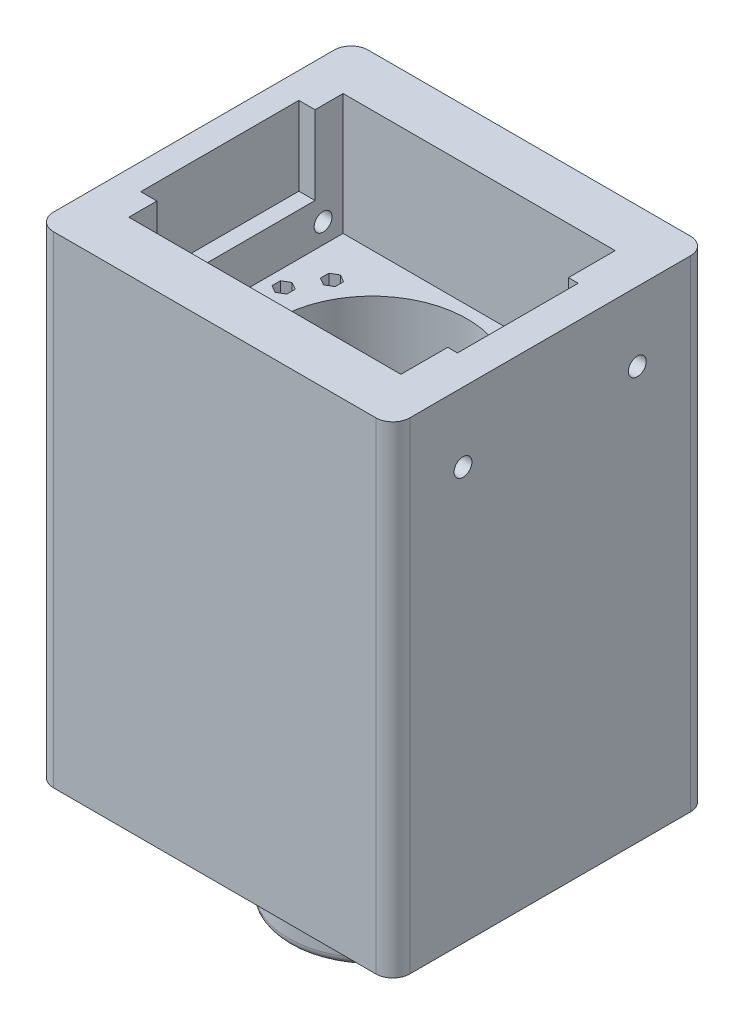
from build123d import *

# Parameters (mm, degrees)
SKETCH1_R                 = 9.8
BOSS_EXTRUDE1_DEPTH       = 15.7
FILLET1_R                 = 1
SKETCH3_W                 = 41.9
SKETCH3_H                 = 37
BOSS_EXTRUDE2_DEPTH       = 37.89
SKETCH2_R                 = 1.55
CUT_EXTRUDE1_DEPTH        = 61.440388814
SKETCH4_W                 = 4.95
SKETCH4_H                 = 37
BOSS_EXTRUDE3_DEPTH       = 14.25
CUT_EXTRUDE_START         = -14.25
CUT_EXTRUDE_2_OUTLINE_W   = 1.15
CUT_EXTRUDE_2_OUTLINE_H   = 14.2
CUT_EXTRUDE_2_OUTLINE_W_2 = 1.900000227
CUT_EXTRUDE_2_OUTLINE_H_2 = 18.6
CUT_EXTRUDE_2_DEPTH       = 14.25
CUT_EXTRUDE_1_REACH       = 83.854
SKETCH_1_R                = 1.05
CUT_EXTRUDE3_START        = -5
SKETCH6_R                 = 1.41
CUT_EXTRUDE3_DEPTH        = 69.371779997
FILLET5_R                 = 2
MOVE_START                = 11.2
MOVE_FACE_1_OUTLINE_R     = 9.8
MOVE_FACE_1_DEPTH         = 4.5
SKETCH_4_R                = 11.200313663
CUT_EXTRUDE_3_DEPTH       = 38.09
SKETCH_6_W                = 2.268388773
SKETCH_6_H                = 19.352707125
EXTRUDE_1_DEPTH           = 5
CUT_EXTRUDE2_REACH        = 83.854
SKETCH5_R                 = 1.05
SKETCH_7_W                = 33.485055755
SKETCH_7_H                = 15.84059592
EXTRUDE_2_DEPTH           = 5.9
SKETCH_8_W                = 34.098293505
SKETCH_8_H                = 15.557673108
EXTRUDE_3_DEPTH           = 5.9
OTHER_START               = 11.2
OTHER_1_DEPTH             = 42.39
SKETCH_9_R                = 3.5
CUT_EXTRUDE_4_DEPTH       = 5


# Read off the part's stored shape, not the designer's step: 切除-拉伸2, 移动面1, 填充阵列1
with BuildPart() as part:
    # Sketch1 → Boss-Extrude1 (new body)
    with BuildSketch(Plane(origin=(0, 0, 0), x_dir=(1, 0, 0), z_dir=(0, 1, 0))):
        with Locations(Location((0, 0, 0), (0, 0, 270))):
            Circle(SKETCH1_R)
    extrude(amount=BOSS_EXTRUDE1_DEPTH)

    # Fillet1
    fillet1_edges = [part.edges().sort_by_distance(p)[0] for p in [
        (0, 0, -9.8),
    ]]
    fillet(fillet1_edges, radius=FILLET1_R)

    # Sketch3 → Boss-Extrude2 (add)
    with BuildSketch(Plane(origin=(0, 15.7, 0), x_dir=(1, 0, 0), z_dir=(0, 1, 0))):
        Rectangle(SKETCH3_W, SKETCH3_H)
    extrude(amount=BOSS_EXTRUDE2_DEPTH)

    # Sketch2 → Cut-Extrude1 (cut, through all)
    with BuildSketch(Plane(origin=(0, 0, 0), x_dir=(-1, 0, 0), z_dir=(0, -1, 0))):
        with Locations(Location((0, 6.999998127, 0), (0, 0, 90))):
            Circle(SKETCH2_R)
        with Locations(Location((6.999998127, 0, 0), (0, 0, 90))):
            Circle(SKETCH2_R)
        with Locations(Location((0, -6.999998127, 0), (0, 0, 90))):
            Circle(SKETCH2_R)
        with Locations(Location((-6.999998127, 0, 0), (0, 0, 90))):
            Circle(SKETCH2_R)
    extrude(amount=-CUT_EXTRUDE1_DEPTH, mode=Mode.SUBTRACT)

    # Sketch4 → Boss-Extrude3 (add)
    with BuildSketch(Plane(origin=(0, 53.59, 0), x_dir=(1, 0, 0), z_dir=(0, 1, 0))):
        with Locations((-18.475, 0)):
            Rectangle(SKETCH4_W, SKETCH4_H)
        with Locations((18.475, 0)):
            Rectangle(SKETCH4_W, SKETCH4_H)
    extrude(amount=BOSS_EXTRUDE3_DEPTH)

    # 切除-拉伸2 outline → 切除-拉伸2 (cut)
    with BuildSketch(Plane(origin=(0, 67.84, 0), x_dir=(1, 0, 0), z_dir=(0, 1, 0)).offset(CUT_EXTRUDE_START)):
        with Locations((16.575, 0)):
            Rectangle(CUT_EXTRUDE_2_OUTLINE_W, CUT_EXTRUDE_2_OUTLINE_H)
        with Locations((-16.950000113, 0)):
            Rectangle(CUT_EXTRUDE_2_OUTLINE_W_2, CUT_EXTRUDE_2_OUTLINE_H_2)
    extrude(amount=CUT_EXTRUDE_2_DEPTH, mode=Mode.SUBTRACT)

    # 草图1 → 切除-拉伸1 (cut, up to next)
    with BuildSketch(Plane(origin=(20.95, 0, 0), x_dir=(0, 0, -1), z_dir=(1, 0, 0)), mode=Mode.PRIVATE) as cut_extrude_1_sk1:
        with Locations((-10.25, 59.7)):
            Circle(SKETCH_1_R)
    cut_extrude_1_tool1 = extrude(cut_extrude_1_sk1.sketch, amount=-CUT_EXTRUDE_1_REACH, mode=Mode.PRIVATE) & part.part
    # 草图1 → 切除-拉伸1 (cut, up to next)
    with BuildSketch(Plane(origin=(20.95, 0, 0), x_dir=(0, 0, -1), z_dir=(1, 0, 0)), mode=Mode.PRIVATE) as cut_extrude_1_sk2:
        with Locations((10.25, 59.7)):
            Circle(SKETCH_1_R)
    cut_extrude_1_tool2 = extrude(cut_extrude_1_sk2.sketch, amount=-CUT_EXTRUDE_1_REACH, mode=Mode.PRIVATE) & part.part
    add(cut_extrude_1_tool1.solids().sort_by_distance((20.95, 59.7, 10.25))[0], mode=Mode.SUBTRACT)
    add(cut_extrude_1_tool2.solids().sort_by_distance((20.95, 59.7, -10.25))[0], mode=Mode.SUBTRACT)

    # Sketch6 → Cut-Extrude3 (cut, through all)
    with BuildSketch(Plane.XZ.offset(CUT_EXTRUDE3_START)):
        with Locations((0, 6.999998127)):
            Circle(SKETCH6_R)
        with Locations((0, -6.999998127)):
            Circle(SKETCH6_R)
        with Locations((-6.999998127, 0)):
            Circle(SKETCH6_R)
        with Locations((6.999998127, 0)):
            Circle(SKETCH6_R)
    extrude(amount=-CUT_EXTRUDE3_DEPTH, mode=Mode.SUBTRACT)

    # Fillet5
    fillet5_edges = [part.edges().sort_by_distance(p)[0] for p in [
        (20.95, 41.77, -18.5),
        (-20.95, 41.77, -18.5),
        (-20.95, 41.77, 18.5),
        (20.95, 41.77, 18.5),
    ]]
    fillet(fillet5_edges, radius=FILLET5_R)

    # Move Face 1 outline → Move Face 1 (add)
    with BuildSketch(Plane(origin=(0, 0, 0), x_dir=(1, 0, 0), z_dir=(0, 1, 0)).offset(MOVE_START)):
        with BuildLine():
            Line((20.95, -16.5), (20.95, 16.5))
            ThreePointArc((20.95, 16.5), (20.364213562, 17.914213562), (18.95, 18.5))
            Line((18.95, 18.5), (-18.95, 18.5))
            ThreePointArc((-18.95, 18.5), (-20.364213562, 17.914213562), (-20.95, 16.5))
            Line((-20.95, 16.5), (-20.95, -16.5))
            ThreePointArc((-20.95, -16.5), (-20.364213562, -17.914213562), (-18.95, -18.5))
            Line((-18.95, -18.5), (18.95, -18.5))
            ThreePointArc((18.95, -18.5), (20.364213562, -17.914213562), (20.95, -16.5))
        make_face()
        Circle(MOVE_FACE_1_OUTLINE_R, mode=Mode.SUBTRACT)
    extrude(amount=MOVE_FACE_1_DEPTH)

    # 草图4 → 切除-拉伸3 (cut)
    with BuildSketch(Plane(origin=(0, 53.59, 0), x_dir=(1, 0, 0), z_dir=(0, 1, 0))):
        with Locations(Location((0, 0, 0), (0, 0, 270))):
            Circle(SKETCH_4_R)
    extrude(amount=-CUT_EXTRUDE_3_DEPTH, mode=Mode.SUBTRACT)

    # 草图6 → 凸台-拉伸1 (add)
    with BuildSketch(Plane(origin=(0, 53.59, 0), x_dir=(1, 0, 0), z_dir=(0, 1, 0))):
        with Locations((-17.13419541, 0.070716348)):
            Rectangle(SKETCH_6_W, SKETCH_6_H)
    extrude(amount=EXTRUDE_1_DEPTH)

    # Sketch5 → Cut-Extrude2 (cut, up to next)
    with BuildSketch(Plane.ZY.offset(20.95), mode=Mode.PRIVATE) as cut_extrude2_sk1:
        with Locations((-10.25, 55.95)):
            Circle(SKETCH5_R)
    cut_extrude2_tool1 = extrude(cut_extrude2_sk1.sketch, amount=-CUT_EXTRUDE2_REACH, mode=Mode.PRIVATE) & part.part
    # Sketch5 → Cut-Extrude2 (cut, up to next)
    with BuildSketch(Plane.ZY.offset(20.95), mode=Mode.PRIVATE) as cut_extrude2_sk2:
        with Locations((10.25, 55.95)):
            Circle(SKETCH5_R)
    cut_extrude2_tool2 = extrude(cut_extrude2_sk2.sketch, amount=-CUT_EXTRUDE2_REACH, mode=Mode.PRIVATE) & part.part
    add(cut_extrude2_tool1.solids().sort_by_distance((-20.95, 55.95, -10.25))[0], mode=Mode.SUBTRACT)
    add(cut_extrude2_tool2.solids().sort_by_distance((-20.95, 55.95, 10.25))[0], mode=Mode.SUBTRACT)

    # 草图7 → 凸台-拉伸2 (add)
    with BuildSketch(Plane.XY.offset(18.5)):
        with Locations((0.159698038, 59.91970204)):
            Rectangle(SKETCH_7_W, SKETCH_7_H)
    extrude(amount=-EXTRUDE_2_DEPTH)

    # 草图8 → 凸台-拉伸3 (add)
    with BuildSketch(Plane(origin=(0, 0, -18.5), x_dir=(-1, 0, 0), z_dir=(0, 0, -1))):
        with Locations((-0.100853247, 60.061163446)):
            Rectangle(SKETCH_8_W, SKETCH_8_H)
    extrude(amount=-EXTRUDE_3_DEPTH)

    # Other 1 outline → Other 1 (cut)
    with BuildSketch(Plane(origin=(0, 0, 0), x_dir=(1, 0, 0), z_dir=(0, 1, 0)).offset(OTHER_START)):
        Polygon((15.149306373, -4.606205589), (16.015331777, -4.106205589), (16.015331777, -3.106205589), (15.149306373, -2.606205589), (14.283280969, -3.106205589), (14.283280969, -4.106205589), align=None)
        Polygon((16.015331777, 3.106205589), (16.015331777, 4.106205589), (15.149306373, 4.606205589), (14.283280969, 4.106205589), (14.283280969, 3.106205589), (15.149306373, 2.606205589), align=None)
        Polygon((-11.917262605, 6.212411178), (-11.051237202, 6.712411178), (-11.051237202, 7.712411178), (-11.917262605, 8.212411178), (-12.783288009, 7.712411178), (-12.783288009, 6.712411178), align=None)
        Polygon((-11.051237202, -7.712411178), (-11.051237202, -6.712411178), (-11.917262605, -6.212411178), (-12.783288009, -6.712411178), (-12.783288009, -7.712411178), (-11.917262605, -8.212411178), align=None)
        Polygon((13.933288009, -6.712411178), (13.067262605, -6.212411178), (12.201237202, -6.712411178), (12.201237202, -7.712411178), (13.067262605, -8.212411178), (13.933288009, -7.712411178), align=None)
        Polygon((13.933288009, -0.5), (13.933288009, 0.5), (13.067262605, 1), (12.201237202, 0.5), (12.201237202, -0.5), (13.067262605, -1), align=None)
        Polygon((13.933288009, 6.712411178), (13.933288009, 7.712411178), (13.067262605, 8.212411178), (12.201237202, 7.712411178), (12.201237202, 6.712411178), (13.067262605, 6.212411178), align=None)
        Polygon((-13.999306373, 2.606205589), (-13.133280969, 3.106205589), (-13.133280969, 4.106205589), (-13.999306373, 4.606205589), (-14.865331777, 4.106205589), (-14.865331777, 3.106205589), align=None)
        Polygon((-13.133280969, -4.106205589), (-13.133280969, -3.106205589), (-13.999306373, -2.606205589), (-14.865331777, -3.106205589), (-14.865331777, -4.106205589), (-13.999306373, -4.606205589), align=None)
    extrude(amount=OTHER_1_DEPTH, mode=Mode.SUBTRACT)

    # 草图9 → 切除-拉伸4 (cut)
    with BuildSketch(Plane.XZ):
        with Locations(Location((0, 0, 0), (0, 0, 270))):
            Circle(SKETCH_9_R)
    extrude(amount=-CUT_EXTRUDE_4_DEPTH, mode=Mode.SUBTRACT)


solid = part.part
